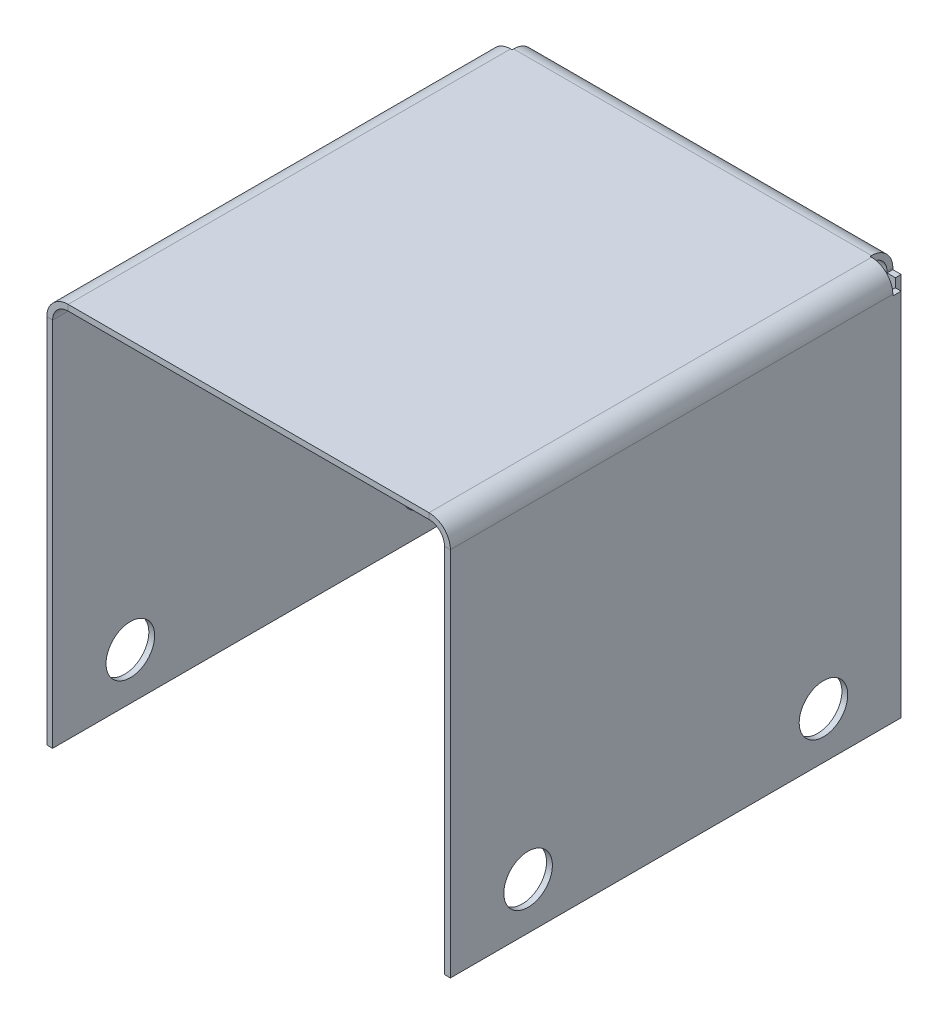
from build123d import *

# Parameters (mm, degrees)
SKETCH1_W              = 65.94348
SKETCH1_H              = 76.02728
BOSS_EXTRUDE1_DEPTH    = 64.0969
CONVERT_SOLID1_START   = -29.75864
CONVERT_SOLID1_DEPTH   = 72.53478
CONVERT_SOLID1_START_2 = -34
CONVERT_SOLID1_2_DEPTH = 4.479485
CONVERT_SOLID1_START_3 = -32.01924
CONVERT_SOLID1_3_DEPTH = 64.03848
CONVERT_SOLID1_4_DEPTH = 1.98076
CONVERT_SOLID1_START_4 = 32.01924
CONVERT_SOLID1_5_DEPTH = 1.98076
CONVERT_SOLID1_START_5 = -32.97174
CONVERT_SOLID1_6_DEPTH = 3.730625
CONVERT_SOLID1_START_6 = 29.241115
CONVERT_SOLID1_7_DEPTH = 3.730625
CONVERT_SOLID1_START_7 = -29.520515
CONVERT_SOLID1_8_DEPTH = 73.520515
CUT_EXTRUDE4_REACH     = 106.765
SKETCH12_R             = 3.96875
CUT_EXTRUDE5_DEPTH     = 102.423632835


with BuildPart() as part:
    # Sketch1 → Boss-Extrude1 (new body)
    with BuildSketch(Plane(origin=(0, 0, 0), x_dir=(1, 0, 0), z_dir=(0, 1, 0))):
        with Locations((0, -4.7625)):
            Rectangle(SKETCH1_W, SKETCH1_H)
    extrude(amount=BOSS_EXTRUDE1_DEPTH)

    # Convert-Solid1: read off the stored shape, not the designer's step
    # Convert-Solid1 outline → Convert-Solid1 (cut)
    with BuildSketch(Plane.XY.offset(CONVERT_SOLID1_START)):
        with BuildLine():
            Line((-32.01924, 0), (32.01924, 0))
            Line((32.01924, 0), (32.01924, 60.6044))
            ThreePointArc((32.01924, 60.6044), (31.275291224, 62.400451224), (29.47924, 63.1444))
            Line((29.47924, 63.1444), (-29.47924, 63.1444))
            ThreePointArc((-29.47924, 63.1444), (-31.275291224, 62.400451224), (-32.01924, 60.6044))
            Line((-32.01924, 60.6044), (-32.01924, 0))
        make_face()
    extrude(amount=CONVERT_SOLID1_DEPTH, mode=Mode.SUBTRACT)

    # Convert-Solid1 2 outline → Convert-Solid1 2 (cut)
    with BuildSketch(Plane.XY.offset(CONVERT_SOLID1_START_2)):
        with BuildLine():
            Line((-30.605026438, 60.366275), (-29.241115, 60.366275))
            Line((-29.241115, 60.366275), (-29.241115, 63.1444))
            Line((-29.241115, 63.1444), (-29.47924, 63.1444))
            ThreePointArc((-29.47924, 63.1444), (-31.275291224, 62.400451224), (-32.01924, 60.6044))
            Line((-32.01924, 60.6044), (-32.01924, 0))
            Line((-32.01924, 0), (-30.605026438, 0))
            Line((-30.605026438, 0), (-30.605026438, 60.366275))
        make_face()
        with BuildLine():
            Line((29.47924, 63.1444), (29.241115, 63.1444))
            Line((29.241115, 63.1444), (29.241115, 60.366275))
            Line((29.241115, 60.366275), (30.605026438, 60.366275))
            Line((30.605026438, 60.366275), (30.605026438, 0))
            Line((30.605026438, 0), (32.01924, 0))
            Line((32.01924, 0), (32.01924, 60.6044))
            ThreePointArc((32.01924, 60.6044), (31.275291224, 62.400451224), (29.47924, 63.1444))
        make_face()
    extrude(amount=CONVERT_SOLID1_2_DEPTH, mode=Mode.SUBTRACT)

    # Convert-Solid1 3 outline → Convert-Solid1 3 (cut)
    with BuildSketch(Plane.YZ.offset(CONVERT_SOLID1_START_3)):
        with BuildLine():
            Line((63.1444, -29.75864), (63.1444, -29.520515))
            Line((63.1444, -29.520515), (60.366275, -29.520515))
            Line((60.366275, -29.520515), (60.366275, -29.75864))
            Line((60.366275, -29.75864), (0, -29.75864))
            Line((0, -29.75864), (0, -32.29864))
            Line((0, -32.29864), (60.6044, -32.29864))
            ThreePointArc((60.6044, -32.29864), (62.400451224, -31.554691224), (63.1444, -29.75864))
        make_face()
        with BuildLine():
            Line((64.0969, -33.25114), (64.0969, -29.75864))
            ThreePointArc((64.0969, -29.75864), (63.073970433, -32.228210433), (60.6044, -33.25114))
            Line((60.6044, -33.25114), (64.0969, -33.25114))
        make_face()
    extrude(amount=CONVERT_SOLID1_3_DEPTH, mode=Mode.SUBTRACT)

    # Convert-Solid1 4 outline → Convert-Solid1 4 (cut)
    with BuildSketch(Plane.YZ.offset(CONVERT_SOLID1_START_2)):
        Polygon((64.0969, 42.77614), (63.1444, 42.77614), (63.1444, -29.520515), (60.366275, -29.520515), (60.366275, -30.884426438), (0, -30.884426438), (0, -33.25114), (64.0969, -33.25114), align=None)
    extrude(amount=CONVERT_SOLID1_4_DEPTH, mode=Mode.SUBTRACT)

    # Convert-Solid1 5 outline → Convert-Solid1 5 (cut)
    with BuildSketch(Plane.YZ.offset(CONVERT_SOLID1_START_4)):
        Polygon((64.0969, 42.77614), (63.1444, 42.77614), (63.1444, -29.520515), (60.366275, -29.520515), (60.366275, -30.884426438), (0, -30.884426438), (0, -33.25114), (64.0969, -33.25114), align=None)
    extrude(amount=CONVERT_SOLID1_5_DEPTH, mode=Mode.SUBTRACT)

    # Convert-Solid1 6 outline → Convert-Solid1 6 (cut)
    with BuildSketch(Plane.YZ.offset(CONVERT_SOLID1_START_5)):
        with BuildLine():
            Line((64.0969, -29.75864), (64.0969, -29.520515))
            Line((64.0969, -29.520515), (63.1444, -29.520515))
            Line((63.1444, -29.520515), (63.1444, -29.75864))
            ThreePointArc((63.1444, -29.75864), (62.400451224, -31.554691224), (60.6044, -32.29864))
            Line((60.6044, -32.29864), (60.366275, -32.29864))
            Line((60.366275, -32.29864), (60.366275, -33.25114))
            Line((60.366275, -33.25114), (60.6044, -33.25114))
            ThreePointArc((60.6044, -33.25114), (63.073970433, -32.228210433), (64.0969, -29.75864))
        make_face()
    extrude(amount=CONVERT_SOLID1_6_DEPTH, mode=Mode.SUBTRACT)

    # Convert-Solid1 7 outline → Convert-Solid1 7 (cut)
    with BuildSketch(Plane.YZ.offset(CONVERT_SOLID1_START_6)):
        with BuildLine():
            Line((64.0969, -29.75864), (64.0969, -29.520515))
            Line((64.0969, -29.520515), (63.1444, -29.520515))
            Line((63.1444, -29.520515), (63.1444, -29.75864))
            ThreePointArc((63.1444, -29.75864), (62.400451224, -31.554691224), (60.6044, -32.29864))
            Line((60.6044, -32.29864), (60.366275, -32.29864))
            Line((60.366275, -32.29864), (60.366275, -33.25114))
            Line((60.366275, -33.25114), (60.6044, -33.25114))
            ThreePointArc((60.6044, -33.25114), (63.073970433, -32.228210433), (64.0969, -29.75864))
        make_face()
    extrude(amount=CONVERT_SOLID1_7_DEPTH, mode=Mode.SUBTRACT)

    # Convert-Solid1 8 outline → Convert-Solid1 8 (cut)
    with BuildSketch(Plane.XY.offset(CONVERT_SOLID1_START_7)):
        with BuildLine():
            Line((32.01924, 64.0969), (29.47924, 64.0969))
            ThreePointArc((29.47924, 64.0969), (31.948810433, 63.073970433), (32.97174, 60.6044))
            Line((32.97174, 60.6044), (32.97174, 63.1444))
            Line((32.97174, 63.1444), (32.01924, 63.1444))
            Line((32.01924, 63.1444), (32.01924, 64.0969))
        make_face()
        with BuildLine():
            ThreePointArc((-32.97174, 60.6044), (-31.948810433, 63.073970433), (-29.47924, 64.0969))
            Line((-29.47924, 64.0969), (-32.01924, 64.0969))
            Line((-32.01924, 64.0969), (-32.01924, 63.1444))
            Line((-32.01924, 63.1444), (-32.97174, 63.1444))
            Line((-32.97174, 63.1444), (-32.97174, 60.6044))
        make_face()
    extrude(amount=CONVERT_SOLID1_8_DEPTH, mode=Mode.SUBTRACT)

    # Sketch7 → Cut-Extrude4 (cut, up to next)
    with BuildSketch(Plane(origin=(0, 0, -33.25114), x_dir=(-1, 0, 0), z_dir=(0, 0, -1)), mode=Mode.PRIVATE) as cut_extrude4_sk1:
        with BuildLine():
            Line((-6.35, 23.1775), (-6.35, 0))
            Line((-6.35, 0), (6.35, 0))
            Line((6.35, 0), (6.35, 23.1775))
            ThreePointArc((6.35, 23.1775), (0, 29.5275), (-6.35, 23.1775))
        make_face()
    cut_extrude4_tool1 = extrude(cut_extrude4_sk1.sketch, amount=-CUT_EXTRUDE4_REACH, mode=Mode.PRIVATE) & part.part
    add(cut_extrude4_tool1.solids().sort_by_distance((0, 14.118049, -33.25114))[0], mode=Mode.SUBTRACT)

    # Sketch12 → Cut-Extrude5 (cut, through all)
    with BuildSketch(Plane.ZY.offset(32.97174)):
        with Locations((-18.184426438, 7.62)):
            Circle(SKETCH12_R)
        with Locations((30.07614, 7.62)):
            Circle(SKETCH12_R)
    extrude(amount=-CUT_EXTRUDE5_DEPTH, mode=Mode.SUBTRACT)


solid = part.part
